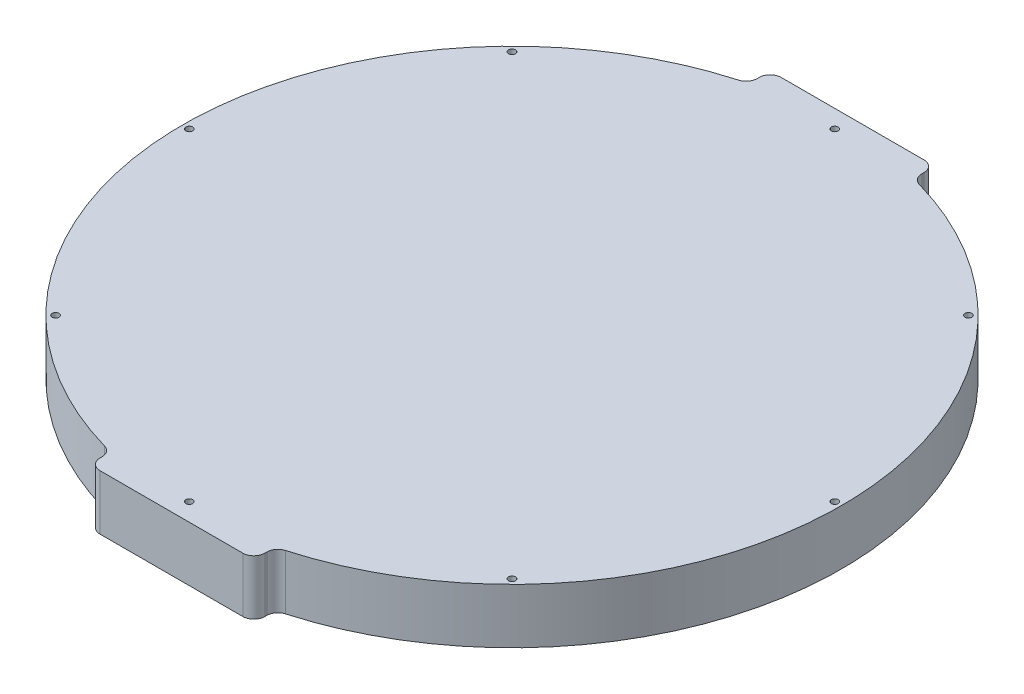
from build123d import *

# Parameters (mm, degrees)
SKETCH2_R                = 76.2
BOSS_EXTRUDE1_DEPTH      = 12.7
BOSS_EXTRUDE2_DEPTH      = 78.74
BOSS_EXTRUDE2_DEPTH_BACK = 78.74
FILLET1_R                = 2.54
SKETCH4_R                = 0.79375
CUT_EXTRUDE1_DEPTH       = 111.307377813


with BuildPart() as part:
    # Sketch2 → Boss-Extrude1 (new body)
    with BuildSketch(Plane(origin=(0, 0, 0), x_dir=(1, 0, 0), z_dir=(0, 1, 0))):
        Circle(SKETCH2_R)
    extrude(amount=BOSS_EXTRUDE1_DEPTH)

    # Sketch3 → Boss-Extrude2 (add, two sides: drawn at the far end of the back side and taken through both)
    with BuildSketch(Plane.XY.offset(-BOSS_EXTRUDE2_DEPTH_BACK)):
        Polygon((0, 0), (-19.05, 0), (-19.05, 12.7), (19.05, 12.7), (19.05, 0), align=None)
    extrude(amount=BOSS_EXTRUDE2_DEPTH + BOSS_EXTRUDE2_DEPTH_BACK)

    # Fillet1
    fillet1_edges = [part.edges().sort_by_distance(p)[0] for p in [
        (19.05, 6.35, 73.780332745),
        (19.05, 6.35, 78.74),
        (-19.05, 6.35, 73.780332745),
        (-19.05, 6.35, 78.74),
        (-19.05, 6.35, -73.780332745),
        (-19.05, 6.35, -78.74),
        (19.05, 6.35, -73.780332745),
        (19.05, 6.35, -78.74),
    ]]
    fillet(fillet1_edges, radius=FILLET1_R)

    # Sketch4 → Cut-Extrude1 (cut, through all)
    with BuildSketch(Plane(origin=(0, 12.7, 0), x_dir=(1, 0, 0), z_dir=(0, 1, 0))):
        with Locations((74.6125, 0)):
            Circle(SKETCH4_R)
        with Locations((52.759004711, -52.759004711)):
            Circle(SKETCH4_R)
        with Locations((0, -74.6125)):
            Circle(SKETCH4_R)
        with Locations((-52.759004711, -52.759004711)):
            Circle(SKETCH4_R)
        with Locations((-74.6125, 0)):
            Circle(SKETCH4_R)
        with Locations((-52.759004711, 52.759004711)):
            Circle(SKETCH4_R)
        with Locations((0, 74.6125)):
            Circle(SKETCH4_R)
        with Locations((52.759004711, 52.759004711)):
            Circle(SKETCH4_R)
    extrude(amount=-CUT_EXTRUDE1_DEPTH, mode=Mode.SUBTRACT)


solid = part.part
